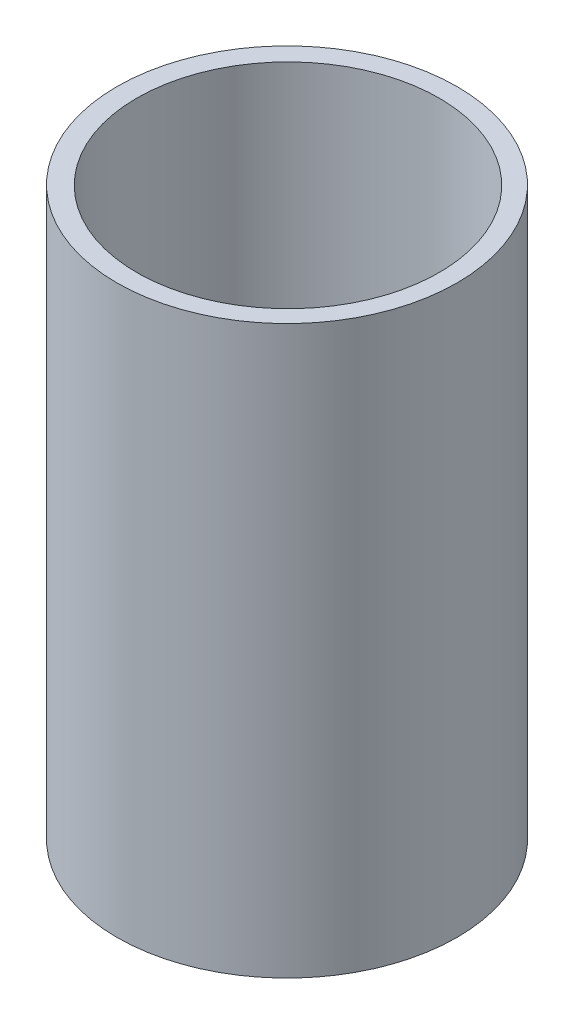
from build123d import *

# Parameters (mm, degrees)
SWEEP1_START       = -30
SWEEP1_OUTLINE_R   = 9
SWEEP1_DEPTH       = 30
SKETCH26_R         = 5
CUT_EXTRUDE1_DEPTH = 15
SKETCH27_R         = 8
CUT_EXTRUDE2_DEPTH = 15


# Read off the part's stored shape, not the designer's step: Sweep1
with BuildPart() as part:
    # Sweep1 outline → Sweep1 (new body)
    with BuildSketch(Plane(origin=(0, 0, 0), x_dir=(1, 0, 0), z_dir=(0, 1, 0)).offset(SWEEP1_START)):
        with Locations((20, 0)):
            Circle(SWEEP1_OUTLINE_R)
    extrude(amount=SWEEP1_DEPTH)

    # Sketch26 → Cut-Extrude1 (cut)
    with BuildSketch(Plane(origin=(0, -30, 0), x_dir=(-1, 0, 0), z_dir=(0, -1, 0))):
        with Locations(Location((-20.053022343, 0, 0), (0, 0, 180))):
            Circle(SKETCH26_R)
    extrude(amount=-CUT_EXTRUDE1_DEPTH, mode=Mode.SUBTRACT)

    # Sketch27 → Cut-Extrude2 (cut)
    with BuildSketch(Plane(origin=(0, 0, 0), x_dir=(1, 0, 0), z_dir=(0, 1, 0))):
        with Locations(Location((20.053022343, 0, 0), (0, 0, 180))):
            Circle(SKETCH27_R)
    extrude(amount=-CUT_EXTRUDE2_DEPTH, mode=Mode.SUBTRACT)


solid = part.part
